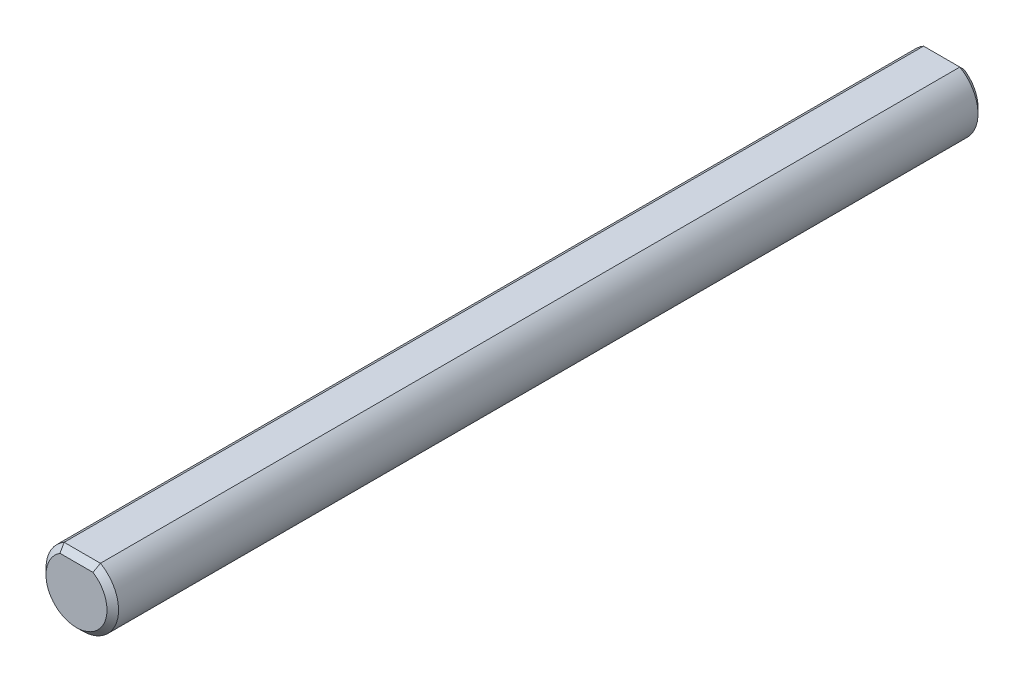
from build123d import *

# Parameters (mm, degrees)
BOSS_EXTRUDE1_DEPTH = 76.2
CHAMFER1_SIZE       = 0.508


with BuildPart() as part:
    # Sketch1 → Boss-Extrude1 (new body)
    with BuildSketch(Plane.XY):
        with BuildLine():
            Line((-1.5875, 2.749630657), (1.5875, 2.749630657))
            ThreePointArc((1.5875, 2.749630657), (0, -3.175), (-1.5875, 2.749630657))
        make_face()
    extrude(amount=BOSS_EXTRUDE1_DEPTH)

    # Chamfer1
    # the kernel refuses this chamfer: 0.508 mm, written as the material it takes off along each edge
    with BuildSketch(Plane(origin=(-2.893914958, 2.749630657, 0), x_dir=(0, 0.027495876610586435, 0.9996219169112968), z_dir=(1, 0, 0))) as chamfer1_piece_1:
        Polygon((CHAMFER1_SIZE * 0.999621916911, CHAMFER1_SIZE * 0.0274958766106), (-CHAMFER1_SIZE * 0.0274958766106, CHAMFER1_SIZE * 0.999621916911), (0, 0), align=None)
    extrude(amount=5.787829916, mode=Mode.SUBTRACT)
    with BuildSketch(Plane(origin=(0, 0, 0), x_dir=(0.11006425826792274, 0.9939244735149306, 0), z_dir=(-0.9939244735149306, 0.11006425826792274, 0))) as chamfer1_piece_2:
        Polygon((3.175, -CHAMFER1_SIZE), (3.175 - CHAMFER1_SIZE, 0), (3.175, 0), align=None)
    revolve(axis=Axis((0, 0, 0), (0, 0, -1)), revolution_arc=347.361960422, mode=Mode.SUBTRACT)
    with BuildSketch(Plane(origin=(0, 0, 76.2), x_dir=(0.11006425826792288, 0.9939244735149306, 0), z_dir=(-0.9939244735149306, 0.11006425826792288, 0))) as chamfer1_piece_3:
        Polygon((3.175, CHAMFER1_SIZE), (3.175 - CHAMFER1_SIZE, 0), (3.175, 0), align=None)
    revolve(axis=Axis((0, 0, 76.2), (0, 0, -1)), revolution_arc=347.361960422, mode=Mode.SUBTRACT)
    with BuildSketch(Plane(origin=(-2.893914958, 2.749630657, 76.2), x_dir=(0, 0.027495876610587017, -0.9996219169112968), z_dir=(1, 0, 0))) as chamfer1_piece_4:
        Polygon((CHAMFER1_SIZE * 0.999621916911, -CHAMFER1_SIZE * 0.0274958766106), (-CHAMFER1_SIZE * 0.0274958766106, -CHAMFER1_SIZE * 0.999621916911), (0, 0), align=None)
    extrude(amount=5.787829916, mode=Mode.SUBTRACT)


solid = part.part
